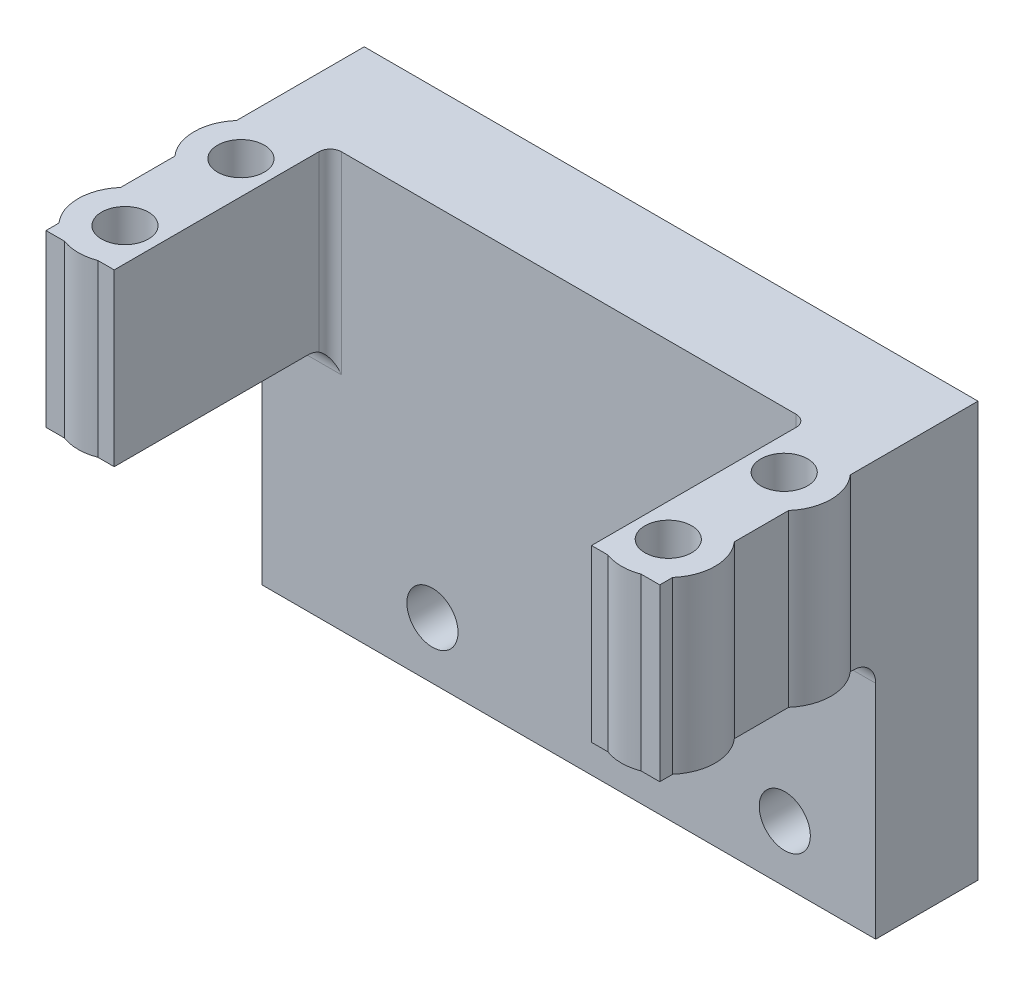
from build123d import *

# Parameters (mm, degrees)
SKETCH1_W           = 54
SKETCH1_H           = 26.5
BOSS_EXTRUDE1_DEPTH = 9
SKETCH2_W           = 6
SKETCH2_H           = 15
BOSS_EXTRUDE2_DEPTH = 19
SKETCH4_R           = 2.06
CUT_EXTRUDE1_DEPTH  = 19
SKETCH5_R           = 2.06
BOSS_EXTRUDE3_DEPTH = 15
SKETCH8_W           = 54
SKETCH8_H           = 10
BOSS_EXTRUDE5_DEPTH = 9
SKETCH9_R           = 2.25
CUT_EXTRUDE3_DEPTH  = 15
MIRROR1_START       = -1.75
MIRROR1_OUTLINE_R   = 2.06
MIRROR1_DEPTH       = 15
FILLET1_R           = 2
FILLET2_R           = 1


# Read off the part's stored shape, not the designer's step: Mirror1
with BuildPart() as part:
    # Sketch1 → Boss-Extrude1 (new body)
    with BuildSketch(Plane.XY):
        Rectangle(SKETCH1_W, SKETCH1_H)
    extrude(amount=BOSS_EXTRUDE1_DEPTH)

    # Sketch2 → Boss-Extrude2 (add)
    with BuildSketch(Plane.XY.offset(9)):
        with Locations((24, 5.75)):
            Rectangle(SKETCH2_W, SKETCH2_H)
    extrude(amount=BOSS_EXTRUDE2_DEPTH)

    # Sketch4 → Cut-Extrude1 (cut)
    with BuildSketch(Plane(origin=(0, 13.25, 0), x_dir=(1, 0, 0), z_dir=(0, 1, 0))):
        with Locations(Location((23.9, -13.949454959, 0), (0, 0, 180))):
            Circle(SKETCH4_R)
        with Locations(Location((23.9, -24.149454959, 0), (0, 0, 180))):
            Circle(SKETCH4_R)
    extrude(amount=-CUT_EXTRUDE1_DEPTH, mode=Mode.SUBTRACT)

    # Sketch5 → Boss-Extrude3 (add)
    # profile 1 of 2: a face of its own
    with BuildSketch(Plane(origin=(0, 13.25, 0), x_dir=(1, 0, 0), z_dir=(0, 1, 0))):
        with BuildLine():
            Line((21, -27.075954574), (21, -21.222955343))
            ThreePointArc((21, -21.222955343), (28.02, -24.149454959), (21, -27.075954574))
        make_face()
        with Locations(Location((23.9, -24.149454959, 0), (0, 0, 180))):
            Circle(SKETCH5_R, mode=Mode.SUBTRACT)
    # profile 2 of 2: a face of its own
    with BuildSketch(Plane(origin=(0, 13.25, 0), x_dir=(1, 0, 0), z_dir=(0, 1, 0))):
        with BuildLine():
            Line((21, -16.875954574), (21, -11.022955343))
            ThreePointArc((21, -11.022955343), (28.02, -13.949454959), (21, -16.875954574))
        make_face()
        with Locations(Location((23.9, -13.949454959, 0), (0, 0, 180))):
            Circle(SKETCH5_R, mode=Mode.SUBTRACT)
    extrude(amount=-BOSS_EXTRUDE3_DEPTH)

    # Sketch8 → Boss-Extrude5 (add, through all)
    with BuildSketch(Plane.XY.offset(9)):
        with Locations((0, -18.25)):
            Rectangle(SKETCH8_W, SKETCH8_H)
    extrude(amount=-BOSS_EXTRUDE5_DEPTH)

    # Sketch9 → Cut-Extrude3 (cut)
    with BuildSketch(Plane.XY.offset(9)):
        with Locations((19, -18.25)):
            Circle(SKETCH9_R)
        with Locations((-12, -18.25)):
            Circle(SKETCH9_R)
    extrude(amount=-CUT_EXTRUDE3_DEPTH, mode=Mode.SUBTRACT)

    # Mirror1 outline → Mirror1 (add)
    with BuildSketch(Plane(origin=(0, 0, 0), x_dir=(1, 0, 0), z_dir=(0, 1, 0)).offset(MIRROR1_START)):
        with BuildLine():
            Line((-27, -9), (-27, -11.235712156))
            ThreePointArc((-27, -11.235712156), (-28.02, -13.949454959), (-27, -16.663197762))
            Line((-27, -16.663197762), (-27, -21.435712156))
            ThreePointArc((-27, -21.435712156), (-28.02, -24.149454959), (-27, -26.863197762))
            Line((-27, -26.863197762), (-27, -28))
            Line((-27, -28), (-25.365504311, -28))
            ThreePointArc((-25.365504311, -28), (-23.9, -28.269454959), (-22.434495689, -28))
            Line((-22.434495689, -28), (-21, -28))
            Line((-21, -28), (-21, -9))
            Line((-21, -9), (-27, -9))
        make_face()
        with Locations((-23.9, -24.149454959)):
            Circle(MIRROR1_OUTLINE_R, mode=Mode.SUBTRACT)
        with Locations((-23.9, -13.949454959)):
            Circle(MIRROR1_OUTLINE_R, mode=Mode.SUBTRACT)
    extrude(amount=MIRROR1_DEPTH)

    # Fillet1
    fillet1_edges = [part.edges().sort_by_distance(p)[0] for p in [
        (-24, -1.75, 9),
        (24, -1.75, 9),
    ]]
    fillet(fillet1_edges, radius=FILLET1_R)

    # Fillet2
    fillet2_edges = [part.edges().sort_by_distance(p)[0] for p in [
        (-21, 4.75, 9),
        (21, 4.75, 9),
    ]]
    fillet(fillet2_edges, radius=FILLET2_R)


solid = part.part
